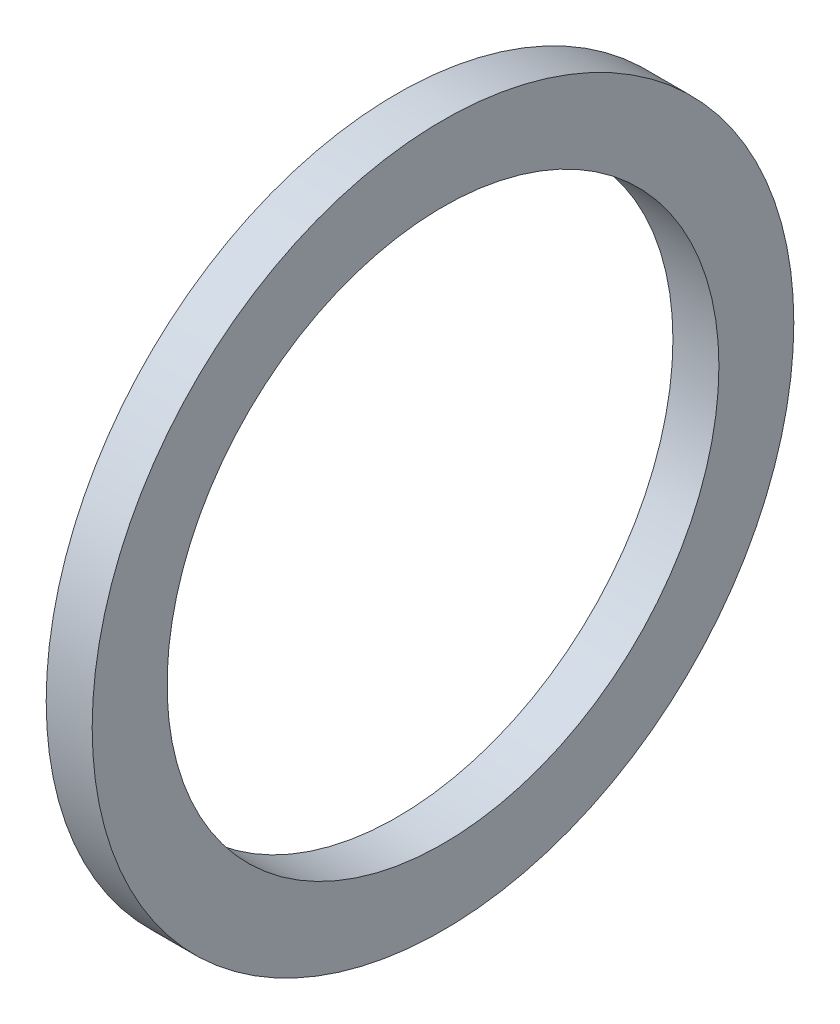
from build123d import *

# Parameters (mm, degrees)
SKETCH1_R           = 76.29
SKETCH1_R_2         = 60
BOSS_EXTRUDE1_DEPTH = 10


with BuildPart() as part:
    # Sketch1 → Boss-Extrude1 (new body)
    with BuildSketch(Plane(origin=(0, 0, 0), x_dir=(0, 0, -1), z_dir=(1, 0, 0))):
        Circle(SKETCH1_R)
        Circle(SKETCH1_R_2, mode=Mode.SUBTRACT)
    extrude(amount=BOSS_EXTRUDE1_DEPTH)


solid = part.part
